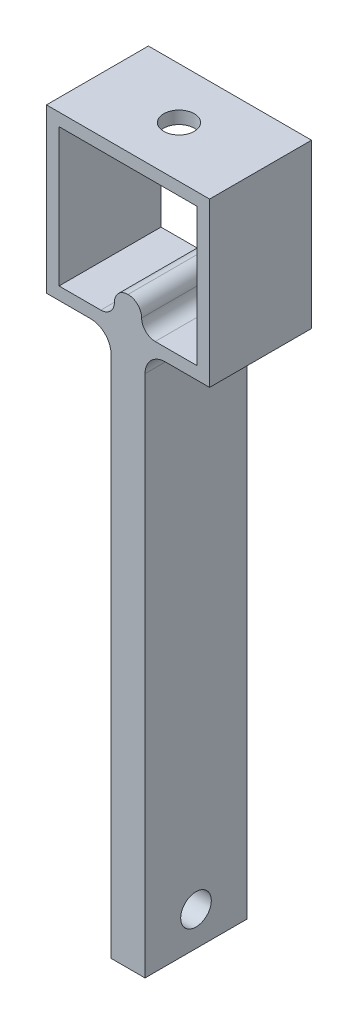
from build123d import *

# Parameters (mm, degrees)
CROQUIS1_W              = 24
CROQUIS1_H              = 24
SALIENTE_EXTRUIR1_DEPTH = 15
CROQUIS2_W              = 20.3
CROQUIS2_H              = 20.3
CORTAR_EXTRUIR1_DEPTH   = 20
CORTAR_EXTRUIR2_REACH   = 32.741
CROQUIS3_R              = 2.25
CROQUIS4_W              = 5
CROQUIS4_H              = 15
SALIENTE_EXTRUIR2_DEPTH = 80
CROQUIS5_W              = 4
CROQUIS5_H              = 4
SALIENTE_EXTRUIR3_DEPTH = 15
REDONDEO1_START         = -1
REDONDEO1_DEPTH         = 17
REDONDEO1_2_DEPTH       = 15
CORTAR_EXTRUIR5_REACH   = 96.336
CROQUIS6_R              = 2.25
REDONDEO3_R             = 3


with BuildPart() as part:
    # Croquis1 → Saliente-Extruir1 (new body)
    with BuildSketch(Plane.XY):
        Rectangle(CROQUIS1_W, CROQUIS1_H)
    extrude(amount=SALIENTE_EXTRUIR1_DEPTH)

    # Croquis2 → Cortar-Extruir1 (cut)
    with BuildSketch(Plane(origin=(0, 0, 0), x_dir=(-1, 0, 0), z_dir=(0, 0, -1))):
        Rectangle(CROQUIS2_W, CROQUIS2_H)
    extrude(amount=-CORTAR_EXTRUIR1_DEPTH, mode=Mode.SUBTRACT)

    # Croquis3 → Cortar-Extruir2 (cut, up to next)
    with BuildSketch(Plane(origin=(0, 12, 0), x_dir=(1, 0, 0), z_dir=(0, 1, 0)), mode=Mode.PRIVATE) as cortar_extruir2_sk1:
        with Locations(Location((0, -7.5, 0), (0, 0, 270))):
            Circle(CROQUIS3_R)
    cortar_extruir2_tool1 = extrude(cortar_extruir2_sk1.sketch, amount=-CORTAR_EXTRUIR2_REACH, mode=Mode.PRIVATE) & part.part
    add(cortar_extruir2_tool1.solids().sort_by_distance((0, 12, 7.5))[0], mode=Mode.SUBTRACT)

    # Croquis4 → Saliente-Extruir2 (add)
    with BuildSketch(Plane.XZ.offset(12)):
        with Locations((0, 7.5)):
            Rectangle(CROQUIS4_W, CROQUIS4_H)
    extrude(amount=SALIENTE_EXTRUIR2_DEPTH)

    # Croquis5 → Saliente-Extruir3 (add)
    with BuildSketch(Plane.XY.offset(15)):
        with Locations((0, -8.15)):
            Rectangle(CROQUIS5_W, CROQUIS5_H)
    extrude(amount=-SALIENTE_EXTRUIR3_DEPTH)

    # Redondeo1: read off the stored shape, not the designer's step
    # Redondeo1 outline → Redondeo1 (cut)
    with BuildSketch(Plane.XY.offset(REDONDEO1_START)):
        with BuildLine():
            ThreePointArc((-2, -8.15), (-1.414213562, -6.735786438), (0, -6.15))
            Line((0, -6.15), (-2, -6.15))
            Line((-2, -6.15), (-2, -8.15))
        make_face()
        with BuildLine():
            ThreePointArc((0, -6.15), (1.414213562, -6.735786438), (2, -8.15))
            Line((2, -8.15), (2, -6.15))
            Line((2, -6.15), (0, -6.15))
        make_face()
    extrude(amount=REDONDEO1_DEPTH, mode=Mode.SUBTRACT)

    # Redondeo1 2 outline → Redondeo1 2 (add)
    with BuildSketch(Plane.XY):
        with BuildLine():
            Line((-2, -10.15), (-2, -8.15))
            ThreePointArc((-2, -8.15), (-2.585786438, -9.564213562), (-4, -10.15))
            Line((-4, -10.15), (-2, -10.15))
        make_face()
        with BuildLine():
            ThreePointArc((4, -10.15), (2.585786438, -9.564213562), (2, -8.15))
            Line((2, -8.15), (2, -10.15))
            Line((2, -10.15), (4, -10.15))
        make_face()
    extrude(amount=REDONDEO1_2_DEPTH)

    # Croquis6 → Cortar-Extruir5 (cut, up to next)
    with BuildSketch(Plane.ZY.offset(2.5), mode=Mode.PRIVATE) as cortar_extruir5_sk1:
        with Locations((7.5, -87)):
            Circle(CROQUIS6_R)
    cortar_extruir5_tool1 = extrude(cortar_extruir5_sk1.sketch, amount=-CORTAR_EXTRUIR5_REACH, mode=Mode.PRIVATE) & part.part
    add(cortar_extruir5_tool1.solids().sort_by_distance((-2.5, -87, 7.5))[0], mode=Mode.SUBTRACT)

    # Redondeo3
    redondeo3_edges = [part.edges().sort_by_distance(p)[0] for p in [
        (-2.5, -12, 7.5),
        (2.5, -12, 7.5),
    ]]
    fillet(redondeo3_edges, radius=REDONDEO3_R)


solid = part.part
